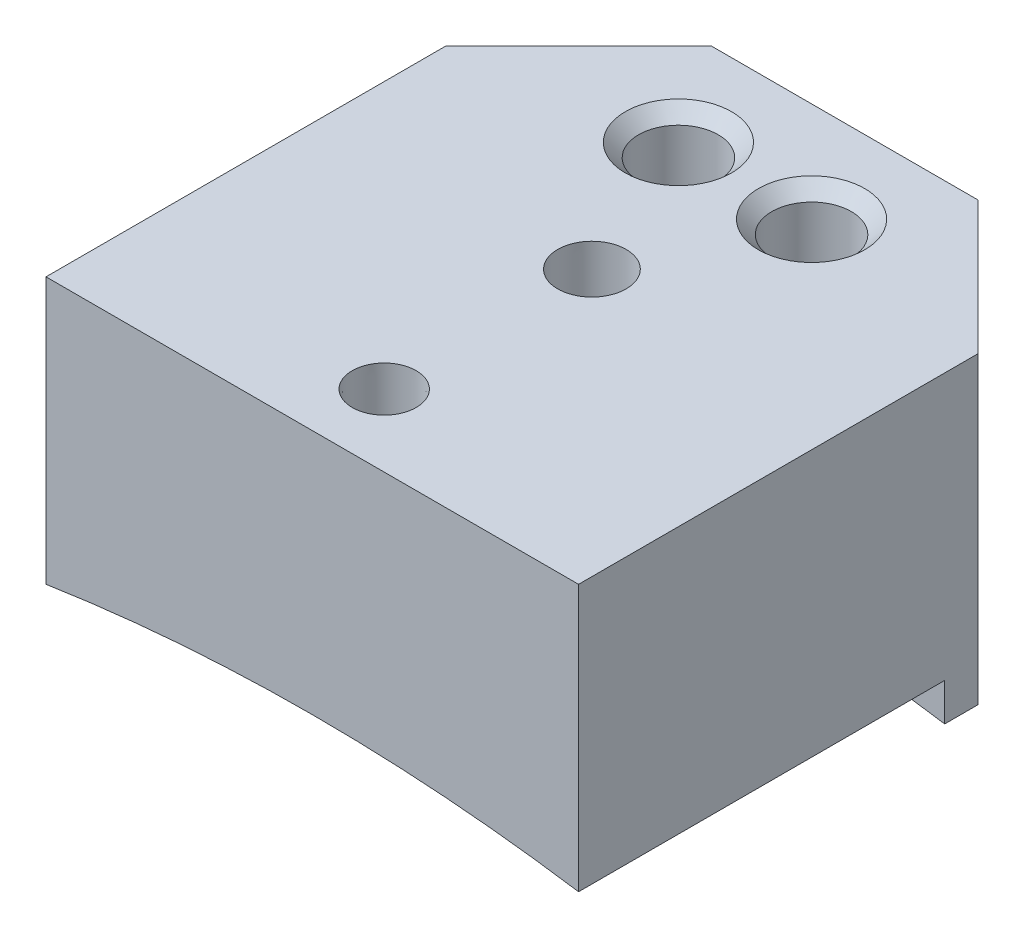
from build123d import *

# Parameters (mm, degrees)
BOSS_EXTRUDE1_DEPTH              = 12.7
CUT_EXTRUDE1_DEPTH               = 41.241448839
CUT_EXTRUDE1_DEPTH_BACK          = 41.241448839
SKETCH2_R                        = 83.82
BOSS_EXTRUDE2_DEPTH              = 7.9375
CHAMFER1_SIZE                    = 6.35
F_10_24_TAPPED_HOLE1_D           = 3.7973
F_10_24_TAPPED_HOLE1_CSINK_D     = 5.0673
F_10_24_TAPPED_HOLE1_CSINK_ANGLE = 90
CUT_EXTRUDE2_DEPTH               = 35.469591438


with BuildPart() as part:
    # Sketch1 → Boss-Extrude1 (new body)
    with BuildSketch(Plane(origin=(0, 0, 0), x_dir=(1, 0, 0), z_dir=(0, 1, 0))):
        Polygon((-28.511825699, 6.495271113), (-22.161825699, 12.845271113), (-9.461825699, 12.845271113), (-3.111825699, 6.495271113), (-3.111825699, -12.554728887), (-28.511825699, -12.554728887), align=None)
    extrude(amount=BOSS_EXTRUDE1_DEPTH)

    # Sketch2 → Cut-Extrude1 (cut, two sides: drawn at the far end of the back side and taken through both)
    with BuildSketch(Plane.XY.offset(12.554728887).offset(-CUT_EXTRUDE1_DEPTH_BACK)):
        with Locations((-15.811825699, -82.852292666)):
            Circle(SKETCH2_R)
    extrude(amount=CUT_EXTRUDE1_DEPTH + CUT_EXTRUDE1_DEPTH_BACK, mode=Mode.SUBTRACT)

    # Sketch5 → Boss-Extrude2 (add)
    with BuildSketch(Plane(origin=(0, 0, -12.845271113), x_dir=(-1, 0, 0), z_dir=(0, 0, -1))):
        with BuildLine():
            Line((3.111825699, 12.7), (3.111825699, 0))
            Line((3.111825699, 0), (3.111825699, -1.799225087))
            ThreePointArc((3.111825699, -1.799225087), (15.811825699, -0.810292666), (28.511825699, -1.799225087))
            Line((28.511825699, -1.799225087), (28.511825699, 0))
            Line((28.511825699, 0), (28.511825699, 12.7))
            Line((28.511825699, 12.7), (3.111825699, 12.7))
        make_face()
    extrude(amount=-BOSS_EXTRUDE2_DEPTH)

    # Chamfer1
    chamfer1_edges = [part.edges().sort_by_distance(p)[0] for p in [
        (-28.511825699, 5.450387457, -12.845271113),
        (-3.111825699, 5.450387457, -12.845271113),
    ]]
    chamfer(chamfer1_edges, length=CHAMFER1_SIZE)

    # #10-24 Tapped Hole1 (through all)
    with Locations(Plane(origin=(0, 12.7, 0), x_dir=(1, 0, 0), z_dir=(0, 1, 0))):
        with Locations((-18.986825699, 8.082771113), (-12.636825699, 8.082771113)):
            CounterSinkHole(F_10_24_TAPPED_HOLE1_D / 2, F_10_24_TAPPED_HOLE1_CSINK_D / 2, counter_sink_angle=F_10_24_TAPPED_HOLE1_CSINK_ANGLE)

    # Sketch6 → Cut-Extrude2 (cut, through all)
    with BuildSketch(Plane(origin=(0, 12.7, 0), x_dir=(1, 0, 0), z_dir=(0, 1, 0))):
        with BuildLine():
            add(Edge.make_bspline(
                [(-15.810187161, -10.649728887), (-15.608816069, -10.649728887), (-15.408777087, -10.609258042), (-15.042113414, -10.456913102), (-14.872283136, -10.343310195), (-14.661403237, -10.132093223), (-14.597095235, -10.053567675), (-14.486747252, -9.887951619), (-14.439987535, -9.800364966), (-14.325350321, -9.523041064), (-14.285983587, -9.325167956), (-14.286290626, -9.023681247), (-14.296234835, -8.924756645), (-14.335129975, -8.729941243), (-14.364583859, -8.633021866), (-14.441157352, -8.448760184), (-14.488024203, -8.361269055), (-14.59887818, -8.19554373), (-14.663276798, -8.117242645), (-14.874254427, -7.906673959), (-15.044430287, -7.793212195), (-15.411336895, -7.641510946), (-15.611812582, -7.601658558), (-15.910183793, -7.601764194), (-16.011184079, -7.611765087), (-16.206424053, -7.650777196), (-16.30141986, -7.679610607), (-16.578437934, -7.794438792), (-16.746192198, -7.906327472), (-16.959455446, -8.119808368), (-17.022421419, -8.196790525), (-17.132721662, -8.361961239), (-17.180436007, -8.451221081), (-17.256716781, -8.635734127), (-17.285478891, -8.730735016), (-17.324351045, -8.926195298), (-17.33424011, -9.027147637), (-17.3340816, -9.325321862), (-17.294056516, -9.525871287), (-17.142043719, -9.892631786), (-17.028500472, -10.062651874), (-16.817622682, -10.273567653), (-16.739189096, -10.337937728), (-16.573527751, -10.448531182), (-16.4859941, -10.495341779), (-16.301435, -10.571837459), (-16.204652049, -10.601138186), (-16.009875231, -10.63984903), (-15.910872707, -10.649728887), (-15.810187161, -10.649728887)],
                knots=[0, 0, 0, 0, 0.0625, 0.0625, 0.125, 0.125, 0.15625, 0.15625, 0.1875, 0.1875, 0.25, 0.25, 0.28125, 0.28125, 0.3125, 0.3125, 0.34375, 0.34375, 0.375, 0.375, 0.4375, 0.4375, 0.5, 0.5, 0.53125, 0.53125, 0.5625, 0.5625, 0.625, 0.625, 0.65625, 0.65625, 0.6875, 0.6875, 0.71875, 0.71875, 0.75, 0.75, 0.8125, 0.8125, 0.875, 0.875, 0.90625, 0.90625, 0.9375, 0.9375, 0.96875, 0.96875, 1, 1, 1, 1], degree=3))
        make_face()
        with BuildLine():
            add(Edge.make_bspline(
                [(-17.442014074, 0.780271113), (-17.442014074, 0.564636284), (-17.398676558, 0.350427917), (-17.235540464, -0.042207871), (-17.113890664, -0.224067842), (-16.887712317, -0.449885239), (-16.803624494, -0.518748425), (-16.626277278, -0.636912744), (-16.532486538, -0.686984635), (-16.235518686, -0.809742063), (-16.023629558, -0.851897237), (-15.700787746, -0.851568442), (-15.594856021, -0.840919858), (-15.386241213, -0.799269638), (-15.2824567, -0.767729417), (-15.085143228, -0.685731965), (-14.991454814, -0.635545363), (-14.813990575, -0.51683914), (-14.730143192, -0.447878932), (-14.50465928, -0.22195697), (-14.383160661, -0.039726886), (-14.220713993, 0.353169004), (-14.178038765, 0.567845014), (-14.178151883, 0.887350822), (-14.188861164, 0.995505271), (-14.230636596, 1.204574676), (-14.261512351, 1.30629934), (-14.343486893, 1.504059479), (-14.394580348, 1.59939761), (-14.512809992, 1.776109619), (-14.580489093, 1.858699522), (-14.732890677, 2.010945721), (-14.815325719, 2.078371766), (-14.992196017, 2.196484915), (-15.087778447, 2.247579015), (-15.285361108, 2.329262955), (-15.387091204, 2.360062361), (-15.596396557, 2.401687932), (-15.704499652, 2.412277461), (-16.023794479, 2.412107726), (-16.238549476, 2.369247574), (-16.631288933, 2.206467282), (-16.813352191, 2.084881425), (-17.03920796, 1.859066471), (-17.10813762, 1.77507717), (-17.226564819, 1.597681506), (-17.276691184, 1.503947566), (-17.358605332, 1.306315551), (-17.389981529, 1.202677168), (-17.431434394, 0.994103708), (-17.442014074, 0.888088528), (-17.442014074, 0.780271113)],
                knots=[0, 0, 0, 0, 0.0625, 0.0625, 0.125, 0.125, 0.15625, 0.15625, 0.1875, 0.1875, 0.25, 0.25, 0.28125, 0.28125, 0.3125, 0.3125, 0.34375, 0.34375, 0.375, 0.375, 0.4375, 0.4375, 0.5, 0.5, 0.53125, 0.53125, 0.5625, 0.5625, 0.59375, 0.59375, 0.625, 0.625, 0.65625, 0.65625, 0.6875, 0.6875, 0.71875, 0.71875, 0.75, 0.75, 0.8125, 0.8125, 0.875, 0.875, 0.90625, 0.90625, 0.9375, 0.9375, 0.96875, 0.96875, 1, 1, 1, 1], degree=3))
        make_face()
    extrude(amount=-CUT_EXTRUDE2_DEPTH, mode=Mode.SUBTRACT)


solid = part.part
